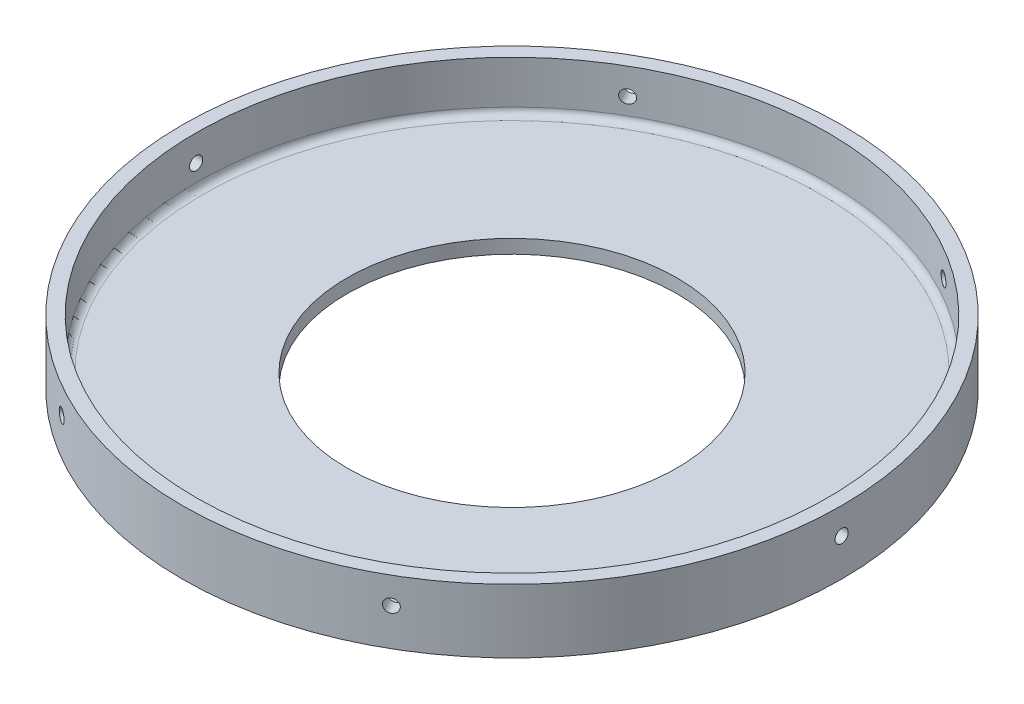
from build123d import *

# Parameters (mm, degrees)
SKETCH1_R           = 76.2
BOSS_EXTRUDE1_DEPTH = 16.256
SHELL1_T            = -3.175
FILLET1_R           = 1.5875
SKETCH2_R           = 38.1
CUT_EXTRUDE1_DEPTH  = 16.256
SKETCH3_R           = 1.524
CUT_EXTRUDE2_DEPTH  = 76.2
CIRPATTERN1_COUNT   = 6
CUT_EXTRUDE4_START  = -1.524
SKETCH5_R           = 76.2
CUT_EXTRUDE4_DEPTH  = 1.524


with BuildPart() as part:
    # Sketch1 → Boss-Extrude1 (new body)
    with BuildSketch(Plane(origin=(0, 0, 0), x_dir=(1, 0, 0), z_dir=(0, 1, 0))):
        Circle(SKETCH1_R)
    extrude(amount=BOSS_EXTRUDE1_DEPTH)

    # Shell1
    shell1_openings = [part.faces().sort_by_distance(p)[0] for p in [
        (0, 16.256, 0),
    ]]
    offset(amount=SHELL1_T, openings=shell1_openings, kind=Kind.INTERSECTION)

    # Fillet1
    fillet1_edges = [part.edges().sort_by_distance(p)[0] for p in [
        (-73.025, 3.175, 0),
    ]]
    fillet(fillet1_edges, radius=FILLET1_R)

    # Sketch2 → Cut-Extrude1 (cut)
    with BuildSketch(Plane.XZ):
        Circle(SKETCH2_R)
    extrude(amount=-CUT_EXTRUDE1_DEPTH, mode=Mode.SUBTRACT)

    # Sketch3 → Cut-Extrude2 (cut)
    with BuildSketch(Plane(origin=(0, 0, 0), x_dir=(0, 0, -1), z_dir=(1, 0, 0))):
        with Locations((0, 8.636)):
            Circle(SKETCH3_R)
    cut_extrude2 = extrude(amount=-CUT_EXTRUDE2_DEPTH, mode=Mode.SUBTRACT)

    # CirPattern1: Cut-Extrude2 ×6 about axis
    cirpattern1_axis = Axis((0, 16.256, 0), (0, -1, 0))
    for i in range(1, CIRPATTERN1_COUNT):
        add(cut_extrude2.rotate(cirpattern1_axis, i * 360 / CIRPATTERN1_COUNT), mode=Mode.SUBTRACT)

    # Sketch5 → Cut-Extrude4 (cut)
    with BuildSketch(Plane(origin=(0, 16.256, 0), x_dir=(1, 0, 0), z_dir=(0, 1, 0)).offset(CUT_EXTRUDE4_START)):
        Circle(SKETCH5_R)
    extrude(amount=CUT_EXTRUDE4_DEPTH, mode=Mode.SUBTRACT)


solid = part.part
